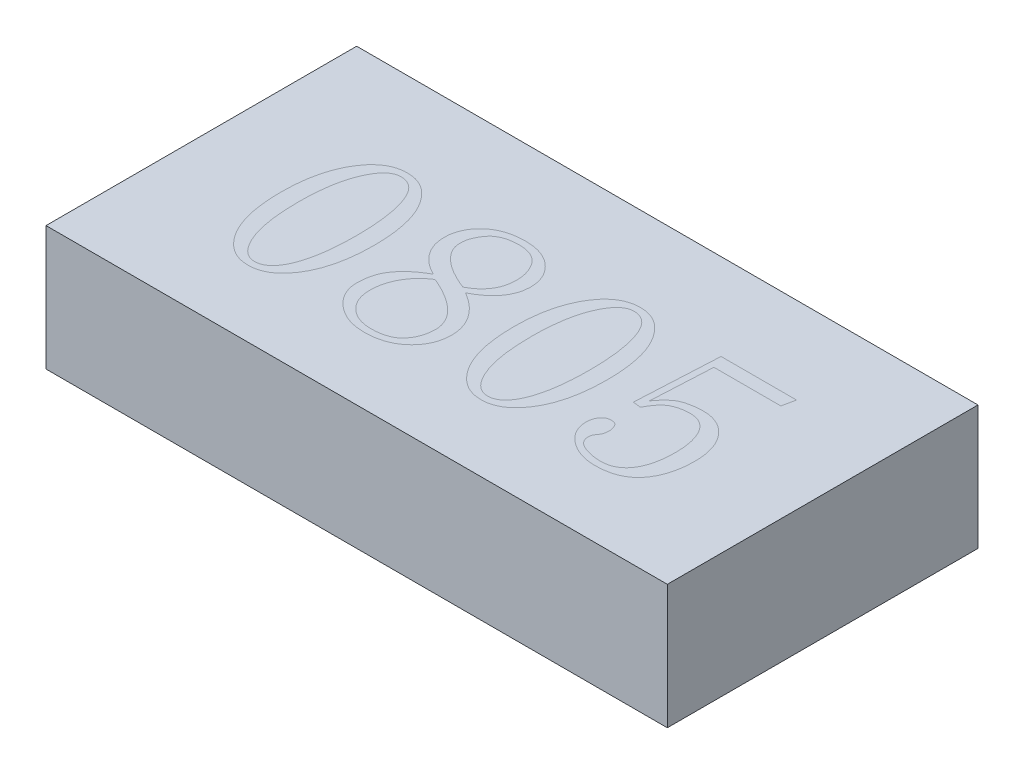
from build123d import *

# Parameters (mm, degrees)
SKETCH_1_W      = 2
SKETCH_1_H      = 1
EXTRUDE_1_DEPTH = 0.4


with BuildPart() as part:
    # 草图1 → 凸台-拉伸1 (new body)
    with BuildSketch(Plane(origin=(0, 0, 0), x_dir=(1, 0, 0), z_dir=(0, 1, 0))):
        with Locations((1, 0.5)):
            Rectangle(SKETCH_1_W, SKETCH_1_H)
    extrude(amount=EXTRUDE_1_DEPTH)


solid = part.part
